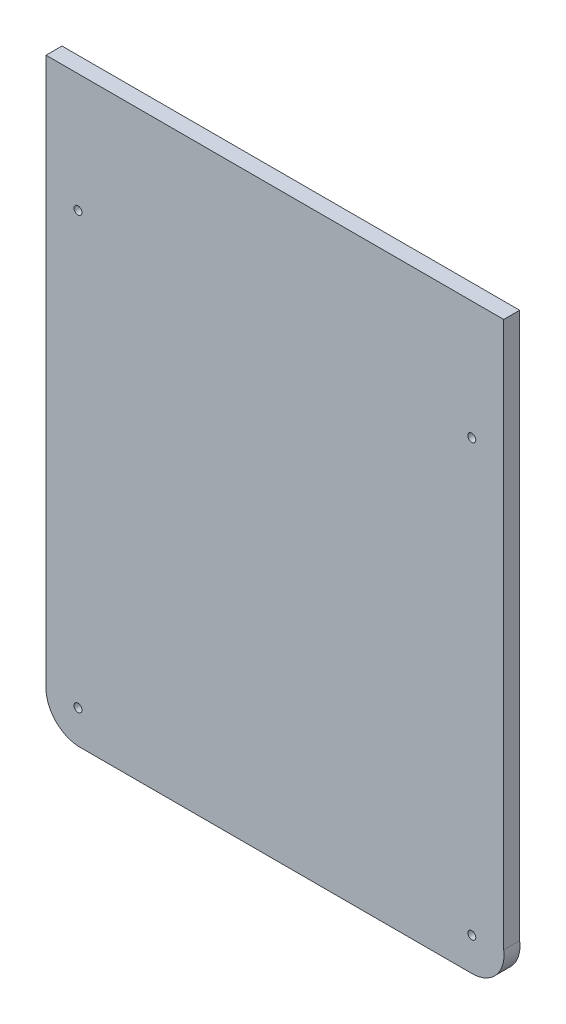
from build123d import *

# Parameters (mm, degrees)
BOSS_EXTRUDE1_DEPTH = 6.35
HOLE1_D             = 3.175
HOLE1_DEPTH         = 31.75
HOLE1_CSINK_D       = 10.16
HOLE1_CSINK_ANGLE   = 82
HOLE1_TIP           = 0.953866233


with BuildPart() as part:
    # Sketch1 → Boss-Extrude1 (new body)
    with BuildSketch(Plane.XY):
        with BuildLine():
            Line((-19.05, 920.17470301), (163.099999994, 920.17470301))
            Line((163.099999994, 920.17470301), (163.099999994, 702.843692969))
            ThreePointArc((163.099999994, 702.843692969), (160.057961653, 692.7131448), (150.399999994, 688.39970301))
            Line((150.399999994, 688.39970301), (-6.35, 688.39970301))
            ThreePointArc((-6.35, 688.39970301), (-15.057025907, 692.392677103), (-19.05, 701.09970301))
            Line((-19.05, 701.09970301), (-19.05, 920.17470301))
        make_face()
    extrude(amount=BOSS_EXTRUDE1_DEPTH)

    # Hole1
    with Locations(Plane(origin=(72.024999997, -419.985067432, 19.05), x_dir=(1, 0, 0), z_dir=(0, 0, 1))):
        with Locations((-78.374999997, 1293.039195846), (-78.374999997, 1121.589195846), (78.374999997, 1121.589195846), (78.374999997, 1293.039195846), (-764.015524801, 1530.078195669)):
            CounterSinkHole(HOLE1_D / 2, HOLE1_CSINK_D / 2, depth=HOLE1_DEPTH, counter_sink_angle=HOLE1_CSINK_ANGLE)
            with Locations((0, 0, -(HOLE1_DEPTH + HOLE1_TIP / 2))):  # 118° drill point
                Cone(0, HOLE1_D / 2, HOLE1_TIP, mode=Mode.SUBTRACT)


solid = part.part
